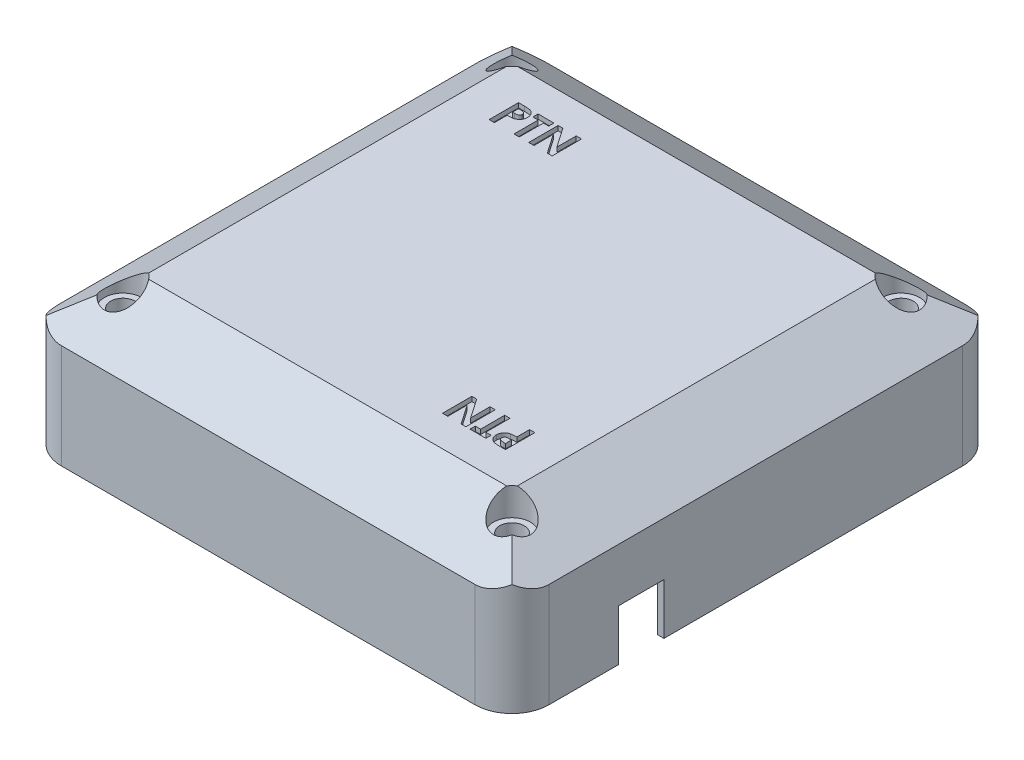
from build123d import *
from OCP.BRepFilletAPI import BRepFilletAPI_MakeChamfer

# Parameters (mm, degrees)
SIDEWALLS_W         = 105.3
SIDEWALLS_H         = 105.3
SIDEWALLS_W_2       = 102.6
SIDEWALLS_H_2       = 102.6
BOSS_EXTRUDE1_DEPTH = 22.5
CEILING_W           = 105.3
CEILING_H           = 105.3
BOSS_EXTRUDE2_DEPTH = 3
DRAFTED_ROOF_W      = 105.3
DRAFTED_ROOF_H      = 105.3
BOSS_EXTRUDE3_DEPTH = 6
CHAMFER1_SIZE       = 9
CHAMFER1_SIZE2      = 12.853332061
SCREWHOLES_HEADS_R  = 4
CUT_EXTRUDE1_DEPTH  = 6
STANDOFFS_R         = 3.65
BOSS_EXTRUDE4_DEPTH = 14.75
CUT_EXTRUDE2_REACH  = 154.212
SCREWHOLES_SHAFTS_R = 2.65
FILLET1_R           = 8
CUT_EXTRUDE3_START  = 30.5
CUT_EXTRUDE3_DEPTH  = 1
CUT_EXTRUDE4_REACH  = 154.212
SMA_PORT_W          = 9.8
SMA_PORT_H          = 11
CUT_EXTRUDE5_REACH  = 154.212
POWERANDCAN_PORT_W  = 4
POWERANDCAN_PORT_H  = 12.5
NRF_MOUNT_W         = 16.8
NRF_MOUNT_H         = 32.8
CUT_EXTRUDE6_DEPTH  = 3.3
CUT_EXTRUDE7_DEPTH  = 3.6
NRF_MOUNT_LIP_W     = 16.8
NRF_MOUNT_LIP_H     = 2
BOSS_EXTRUDE5_DEPTH = 3
FILLET2_R           = 2


# Read off the part's stored shape, not the designer's step: Cut-Extrude3
with BuildPart() as part:
    # Sidewalls → Boss-Extrude1 (new body)
    with BuildSketch(Plane(origin=(0, 0, 0), x_dir=(1, 0, 0), z_dir=(0, 1, 0))):
        with Locations((52.65, -52.65)):
            Rectangle(SIDEWALLS_W, SIDEWALLS_H)
        with Locations((52.65, -52.65)):
            Rectangle(SIDEWALLS_W_2, SIDEWALLS_H_2, mode=Mode.SUBTRACT)
    extrude(amount=BOSS_EXTRUDE1_DEPTH)

    # Ceiling → Boss-Extrude2 (add)
    with BuildSketch(Plane(origin=(0, 22.5, 0), x_dir=(1, 0, 0), z_dir=(0, 1, 0))):
        with Locations((52.65, -52.65)):
            Rectangle(CEILING_W, CEILING_H)
    extrude(amount=BOSS_EXTRUDE2_DEPTH)

    # Drafted_Roof → Boss-Extrude3 (add)
    with BuildSketch(Plane(origin=(0, 25.5, 0), x_dir=(1, 0, 0), z_dir=(0, 1, 0))):
        with Locations((52.65, -52.65)):
            Rectangle(DRAFTED_ROOF_W, DRAFTED_ROOF_H)
    extrude(amount=BOSS_EXTRUDE3_DEPTH)

    # Chamfer1: one chamfer whose edges measure the first distance from different faces: ONE call of the kernel's chamfer builder (chamfer() names one face for all edges)
    chamfer1_edges_1 = [part.edges().sort_by_distance(p)[0] for p in [
        (0, 31.5, 52.65),
    ]]
    chamfer1_side_1 = [part.faces().sort_by_distance(p)[0] for p in [
        (0, 15.75, 52.65),
    ]]
    chamfer1_edges_2 = [part.edges().sort_by_distance(p)[0] for p in [
        (52.65, 31.5, 105.3),
    ]]
    chamfer1_side_2 = [part.faces().sort_by_distance(p)[0] for p in [
        (52.65, 15.75, 105.3),
    ]]
    chamfer1_edges_3 = [part.edges().sort_by_distance(p)[0] for p in [
        (105.3, 31.5, 52.65),
    ]]
    chamfer1_side_3 = [part.faces().sort_by_distance(p)[0] for p in [
        (105.3, 15.75, 52.65),
    ]]
    chamfer1_edges_4 = [part.edges().sort_by_distance(p)[0] for p in [
        (52.65, 31.5, 0),
    ]]
    chamfer1_side_4 = [part.faces().sort_by_distance(p)[0] for p in [
        (52.65, 15.75, 0),
    ]]
    chamfer1 = BRepFilletAPI_MakeChamfer(part.part.solid().wrapped)
    for e in chamfer1_edges_1:
        chamfer1.Add(CHAMFER1_SIZE, CHAMFER1_SIZE2, e.wrapped, chamfer1_side_1[0].wrapped)  # the first distance lies on this face
    for e in chamfer1_edges_2:
        chamfer1.Add(CHAMFER1_SIZE, CHAMFER1_SIZE2, e.wrapped, chamfer1_side_2[0].wrapped)  # the first distance lies on this face
    for e in chamfer1_edges_3:
        chamfer1.Add(CHAMFER1_SIZE, CHAMFER1_SIZE2, e.wrapped, chamfer1_side_3[0].wrapped)  # the first distance lies on this face
    for e in chamfer1_edges_4:
        chamfer1.Add(CHAMFER1_SIZE, CHAMFER1_SIZE2, e.wrapped, chamfer1_side_4[0].wrapped)  # the first distance lies on this face
    add(Compound.cast(chamfer1.Shape()), mode=Mode.REPLACE)

    # ScrewHoles_Heads → Cut-Extrude1 (cut)
    with BuildSketch(Plane(origin=(0, 31.5, 0), x_dir=(1, 0, 0), z_dir=(0, 1, 0))):
        with Locations(Location((10.65, -10.65, 0), (0, 0, 270))):
            Circle(SCREWHOLES_HEADS_R)
        with Locations(Location((94.65, -10.65, 0), (0, 0, 270))):
            Circle(SCREWHOLES_HEADS_R)
        with Locations(Location((94.65, -94.65, 0), (0, 0, 270))):
            Circle(SCREWHOLES_HEADS_R)
        with Locations(Location((10.65, -94.65, 0), (0, 0, 270))):
            Circle(SCREWHOLES_HEADS_R)
    extrude(amount=-CUT_EXTRUDE1_DEPTH, mode=Mode.SUBTRACT)

    # Standoffs → Boss-Extrude4 (add)
    with BuildSketch(Plane.XZ.offset(-22.5)):
        with Locations(Location((10.65, 94.65, 0), (0, 0, 90))):
            Circle(STANDOFFS_R)
        with Locations(Location((94.65, 94.65, 0), (0, 0, 90))):
            Circle(STANDOFFS_R)
        with Locations(Location((94.65, 10.65, 0), (0, 0, 90))):
            Circle(STANDOFFS_R)
        with Locations(Location((10.65, 10.65, 0), (0, 0, 90))):
            Circle(STANDOFFS_R)
    extrude(amount=BOSS_EXTRUDE4_DEPTH)

    # ScrewHoles_Shafts → Cut-Extrude2 (cut, up to next)
    with BuildSketch(Plane(origin=(0, 31.5, 0), x_dir=(1, 0, 0), z_dir=(0, 1, 0)), mode=Mode.PRIVATE) as cut_extrude2_sk1:
        with Locations(Location((10.65, -10.65, 0), (0, 0, 270))):
            Circle(SCREWHOLES_SHAFTS_R)
    cut_extrude2_tool1 = extrude(cut_extrude2_sk1.sketch, amount=-CUT_EXTRUDE2_REACH, mode=Mode.PRIVATE) & part.part
    # ScrewHoles_Shafts → Cut-Extrude2 (cut, up to next)
    with BuildSketch(Plane(origin=(0, 31.5, 0), x_dir=(1, 0, 0), z_dir=(0, 1, 0)), mode=Mode.PRIVATE) as cut_extrude2_sk2:
        with Locations(Location((94.65, -10.65, 0), (0, 0, 270))):
            Circle(SCREWHOLES_SHAFTS_R)
    cut_extrude2_tool2 = extrude(cut_extrude2_sk2.sketch, amount=-CUT_EXTRUDE2_REACH, mode=Mode.PRIVATE) & part.part
    # ScrewHoles_Shafts → Cut-Extrude2 (cut, up to next)
    with BuildSketch(Plane(origin=(0, 31.5, 0), x_dir=(1, 0, 0), z_dir=(0, 1, 0)), mode=Mode.PRIVATE) as cut_extrude2_sk3:
        with Locations(Location((94.65, -94.65, 0), (0, 0, 270))):
            Circle(SCREWHOLES_SHAFTS_R)
    cut_extrude2_tool3 = extrude(cut_extrude2_sk3.sketch, amount=-CUT_EXTRUDE2_REACH, mode=Mode.PRIVATE) & part.part
    # ScrewHoles_Shafts → Cut-Extrude2 (cut, up to next)
    with BuildSketch(Plane(origin=(0, 31.5, 0), x_dir=(1, 0, 0), z_dir=(0, 1, 0)), mode=Mode.PRIVATE) as cut_extrude2_sk4:
        with Locations(Location((10.65, -94.65, 0), (0, 0, 270))):
            Circle(SCREWHOLES_SHAFTS_R)
    cut_extrude2_tool4 = extrude(cut_extrude2_sk4.sketch, amount=-CUT_EXTRUDE2_REACH, mode=Mode.PRIVATE) & part.part
    add(cut_extrude2_tool1.solids().sort_by_distance((10.65, 31.5, 10.65))[0], mode=Mode.SUBTRACT)
    add(cut_extrude2_tool2.solids().sort_by_distance((94.65, 31.5, 10.65))[0], mode=Mode.SUBTRACT)
    add(cut_extrude2_tool3.solids().sort_by_distance((94.65, 31.5, 94.65))[0], mode=Mode.SUBTRACT)
    add(cut_extrude2_tool4.solids().sort_by_distance((10.65, 31.5, 94.65))[0], mode=Mode.SUBTRACT)

    # Fillet1
    fillet1_edges = [part.edges().sort_by_distance(p)[0] for p in [
        (1.35, 11.25, 103.95),
        (103.95, 11.25, 103.95),
        (103.95, 11.25, 1.35),
        (1.35, 11.25, 1.35),
        (105.3, 11.25, 105.3),
        (0, 11.25, 105.3),
        (105.3, 11.25, 0),
        (0, 11.25, 0),
    ]]
    fillet(fillet1_edges, radius=FILLET1_R)

    # Cut-Extrude3 outline → Cut-Extrude3 (cut)
    # profile 1 of 6: a face of its own
    with BuildSketch(Plane(origin=(0, 0, 0), x_dir=(1, 0, 0), z_dir=(0, 1, 0)).offset(CUT_EXTRUDE3_START)):
        with BuildLine():
            add(Edge.make_bspline(
                [(83.115017298, -85.796667939), (83.031904164, -85.796295908), (82.871561507, -85.795578181), (82.640334212, -85.786874768), (82.427015682, -85.771277764), (82.231655054, -85.752002205), (82.054332236, -85.72497906), (81.894826525, -85.693997802), (81.753100463, -85.656257971), (81.627569881, -85.61144743), (81.514875491, -85.558663763), (81.408355558, -85.502284962), (81.309613278, -85.435456622), (81.216330463, -85.362995861), (81.129212751, -85.283395196), (81.047614584, -85.196969227), (80.972376195, -85.102461934), (80.903969281, -85.000524385), (80.841879575, -84.893231959), (80.78764288, -84.780339983), (80.743646807, -84.661684194), (80.70674022, -84.538028274), (80.677096316, -84.40937868), (80.657364433, -84.27494391), (80.643961532, -84.13566272), (80.642778912, -84.040867851), (80.64218076, -83.992921946)],
                knots=[0, 0, 0, 0, 0.070782813, 0.136554884, 0.197017081, 0.252928598, 0.303693621, 0.349727315, 0.391249604, 0.428488557, 0.463067374, 0.497161963, 0.531014729, 0.564460573, 0.597691279, 0.631412817, 0.665589541, 0.700444444, 0.735874519, 0.771086765, 0.806970339, 0.84353075, 0.880937416, 0.9192925, 0.959179287, 1, 1, 1, 1], degree=3))
            Line((83.115017298, -85.796667939), (84.387052555, -85.796667939))
            Line((84.387052555, -85.796667939), (84.387052555, -79.446667939))
            Line((84.387052555, -79.446667939), (83.247308965, -79.446667939))
            Line((83.247308965, -79.446667939), (83.247308965, -82.214616657))
            add(Edge.make_bspline(
                [(81.953649109, -82.311291337), (81.986201424, -82.303192268), (82.056720221, -82.285647077), (82.173409461, -82.267834305), (82.307881558, -82.251456556), (82.460571349, -82.237381863), (82.631566863, -82.227814352), (82.820702531, -82.220342551), (83.028064066, -82.21490978), (83.172255079, -82.214717002), (83.247308965, -82.214616657)],
                knots=[0, 0, 0, 0, 0.077372749, 0.167614291, 0.272108317, 0.390015992, 0.52136331, 0.667272254, 0.826809521, 1, 1, 1, 1], degree=3))
            add(Edge.make_bspline(
                [(80.64218076, -83.992921946), (80.64304246, -83.939878997), (80.644735808, -83.835643083), (80.661461484, -83.682872213), (80.689752043, -83.537119882), (80.72762518, -83.397763434), (80.777025408, -83.26510774), (80.838940428, -83.140024242), (80.90976273, -83.020945552), (80.993371274, -82.91004963), (81.085758981, -82.806771968), (81.185239424, -82.709988644), (81.294797561, -82.623677632), (81.410522921, -82.54335173), (81.535726733, -82.473725736), (81.666699447, -82.409254969), (81.806762904, -82.354545618), (81.904232449, -82.325843296), (81.953649109, -82.311291337)],
                knots=[0, 0, 0, 0, 0.068860469, 0.135319284, 0.199246039, 0.261493284, 0.322649767, 0.382733531, 0.442506181, 0.502301651, 0.562750119, 0.622329724, 0.682264456, 0.743658422, 0.805054856, 0.86809577, 0.933125096, 1, 1, 1, 1], degree=3))
        make_face()
        with BuildLine():
            add(Edge.make_bspline(
                [(82.080852635, -84.530992859), (82.101010789, -84.541187416), (82.143689731, -84.562771381), (82.216376109, -84.587864318), (82.300255078, -84.609032975), (82.395892917, -84.626602757), (82.502908099, -84.640238731), (82.62128153, -84.650666841), (82.751187409, -84.65486039), (82.841529174, -84.656217387), (82.888595023, -84.65692435)],
                knots=[0, 0, 0, 0, 0.08210116, 0.173824981, 0.278953094, 0.396639095, 0.527315592, 0.671298143, 0.82875438, 1, 1, 1, 1], degree=3))
            add(Edge.make_bspline(
                [(81.78192435, -83.994193981), (81.782919522, -84.023938621), (81.784850394, -84.081650373), (81.799230601, -84.164884164), (81.821549415, -84.242323048), (81.855659392, -84.312887549), (81.897072012, -84.37822352), (81.949609071, -84.436297036), (82.010195099, -84.488986972), (82.057048768, -84.516841466), (82.080852635, -84.530992859)],
                knots=[0, 0, 0, 0, 0.137806221, 0.267377201, 0.390496855, 0.51006691, 0.629459141, 0.747795142, 0.871868075, 1, 1, 1, 1], degree=3))
            add(Edge.make_bspline(
                [(82.844073789, -83.354360247), (82.770697583, -83.354823769), (82.635684274, -83.355676658), (82.451320429, -83.368075706), (82.303113504, -83.386927123), (82.186155855, -83.41418511), (82.093771085, -83.454772323), (82.015049694, -83.503724711), (81.945110657, -83.56254988), (81.886810975, -83.633072094), (81.839302368, -83.711752438), (81.805980389, -83.79918502), (81.784948985, -83.893972573), (81.782951554, -83.96015753), (81.78192435, -83.994193981)],
                knots=[0, 0, 0, 0, 0.155195977, 0.285562903, 0.390594379, 0.471085489, 0.538571793, 0.603033861, 0.666660558, 0.730972685, 0.795733593, 0.86019566, 0.92810385, 1, 1, 1, 1], degree=3))
            Line((82.844073789, -83.354360247), (83.247308965, -83.354360247))
            Line((83.247308965, -83.354360247), (83.247308965, -84.65692435))
            Line((83.247308965, -84.65692435), (82.888595023, -84.65692435))
        make_face(mode=Mode.SUBTRACT)
    # profile 2 of 6: a face of its own
    with BuildSketch(Plane(origin=(0, 0, 0), x_dir=(1, 0, 0), z_dir=(0, 1, 0)).offset(CUT_EXTRUDE3_START)):
        with BuildLine():
            add(Edge.make_bspline(
                [(22.184982702, -19.503332061), (22.268095835, -19.503704093), (22.428438491, -19.504421821), (22.659665793, -19.513125226), (22.872984301, -19.528722257), (23.068345004, -19.547997722), (23.245667576, -19.575021174), (23.405174078, -19.606001445), (23.546897611, -19.643744433), (23.672436318, -19.688544835), (23.785103253, -19.74136276), (23.891722512, -19.79761762), (23.989884487, -19.864755811), (24.084543711, -19.935541464), (24.170288353, -20.016736706), (24.252467675, -20.102937875), (24.327601161, -20.197563639), (24.39603695, -20.299468578), (24.458118756, -20.406769925), (24.512357575, -20.519659503), (24.556353067, -20.638315948), (24.593259815, -20.761971687), (24.622903674, -20.890621331), (24.64263557, -21.025056087), (24.656038467, -21.164337281), (24.657221087, -21.25913215), (24.65781924, -21.307078054)],
                knots=[0, 0, 0, 0, 0.070781161, 0.136551696, 0.197012482, 0.252922694, 0.303686532, 0.349719151, 0.391240471, 0.428478555, 0.463056565, 0.497150358, 0.531002334, 0.564226377, 0.59770067, 0.631421421, 0.665597347, 0.700451436, 0.735880684, 0.771092108, 0.806974845, 0.843534403, 0.880940196, 0.919294384, 0.95918024, 1, 1, 1, 1], degree=3))
            Line((22.184982702, -19.503332061), (20.912947445, -19.503332061))
            Line((20.912947445, -19.503332061), (20.912947445, -25.853332061))
            Line((20.912947445, -25.853332061), (22.052691035, -25.853332061))
            Line((22.052691035, -25.853332061), (22.052691035, -23.085383343))
            add(Edge.make_bspline(
                [(23.346350891, -22.988708663), (23.313798576, -22.996807732), (23.243279779, -23.014352923), (23.126590539, -23.032165695), (22.992118442, -23.048543444), (22.839428651, -23.062618137), (22.668433137, -23.072185648), (22.479297469, -23.079657449), (22.271935934, -23.08509022), (22.127744921, -23.085282998), (22.052691035, -23.085383343)],
                knots=[0, 0, 0, 0, 0.077372749, 0.167614291, 0.272108317, 0.390015992, 0.52136331, 0.667272254, 0.826809521, 1, 1, 1, 1], degree=3))
            add(Edge.make_bspline(
                [(24.65781924, -21.307078054), (24.656953788, -21.360119467), (24.655253068, -21.464352361), (24.638580533, -21.617144995), (24.610098575, -21.762818938), (24.572874146, -21.902602685), (24.520967327, -22.034196482), (24.461666224, -22.160740199), (24.388707058, -22.278685937), (24.305339546, -22.389509057), (24.214292713, -22.494110601), (24.11340511, -22.589470399), (24.004599698, -22.676238515), (23.888506312, -22.755324286), (23.764689104, -22.826568177), (23.633237414, -22.890637313), (23.493253614, -22.945482563), (23.395773108, -22.974166185), (23.346350891, -22.988708663)],
                knots=[0, 0, 0, 0, 0.068875425, 0.135348675, 0.199289315, 0.26155008, 0.322915384, 0.382771997, 0.442843572, 0.502652029, 0.562748843, 0.622739582, 0.682687332, 0.743329247, 0.805012514, 0.86806712, 0.933110571, 1, 1, 1, 1], degree=3))
        make_face()
        with BuildLine():
            add(Edge.make_bspline(
                [(23.219147365, -20.769007141), (23.198989211, -20.758812584), (23.156310269, -20.737228619), (23.083623891, -20.712135682), (22.999744922, -20.690967025), (22.904107083, -20.673397243), (22.797091901, -20.659761269), (22.67871847, -20.649333159), (22.548812591, -20.64513961), (22.458470826, -20.643782613), (22.411404977, -20.64307565)],
                knots=[0, 0, 0, 0, 0.08210116, 0.173824981, 0.278953094, 0.396639095, 0.527315592, 0.671298143, 0.82875438, 1, 1, 1, 1], degree=3))
            add(Edge.make_bspline(
                [(23.51807565, -21.305806019), (23.517073475, -21.276064938), (23.515129014, -21.218360091), (23.500844475, -21.135077684), (23.478079029, -21.0574413), (23.445092772, -20.986261749), (23.402449353, -20.921659975), (23.350458396, -20.863661428), (23.289787046, -20.811024021), (23.242945217, -20.783162237), (23.219147365, -20.769007141)],
                knots=[0, 0, 0, 0, 0.137787685, 0.267341238, 0.390444331, 0.511777883, 0.629508981, 0.747829066, 0.87188531, 1, 1, 1, 1], degree=3))
            add(Edge.make_bspline(
                [(22.455926211, -21.945639753), (22.529301218, -21.945174498), (22.66431232, -21.944318423), (22.848689808, -21.931939079), (22.996859105, -21.913033319), (23.1139156, -21.885918087), (23.206342791, -21.844767132), (23.286055456, -21.797163227), (23.354427044, -21.736969395), (23.413626776, -21.668187643), (23.460955178, -21.589153962), (23.493774959, -21.501155263), (23.515094044, -21.406040492), (23.517063059, -21.339846907), (23.51807565, -21.305806019)],
                knots=[0, 0, 0, 0, 0.155159592, 0.285495954, 0.390502806, 0.470975045, 0.538445527, 0.60365534, 0.666587169, 0.73019895, 0.794944675, 0.860228437, 0.928120706, 1, 1, 1, 1], degree=3))
            Line((22.455926211, -21.945639753), (22.052691035, -21.945639753))
            Line((22.052691035, -21.945639753), (22.052691035, -20.64307565))
            Line((22.052691035, -20.64307565), (22.411404977, -20.64307565))
        make_face(mode=Mode.SUBTRACT)
    # profile 3 of 6: a face of its own
    with BuildSketch(Plane(origin=(0, 0, 0), x_dir=(1, 0, 0), z_dir=(0, 1, 0)).offset(CUT_EXTRUDE3_START)):
        Polygon((25.146280779, -19.503332061), (25.146280779, -20.64307565), (26.286024368, -20.64307565), (26.286024368, -25.853332061), (27.425767958, -25.853332061), (27.425767958, -20.64307565), (28.565511548, -20.64307565), (28.565511548, -19.503332061), align=None)
    # profile 4 of 6: a face of its own
    with BuildSketch(Plane(origin=(0, 0, 0), x_dir=(1, 0, 0), z_dir=(0, 1, 0)).offset(CUT_EXTRUDE3_START)):
        Polygon((30.48755682, -19.503332061), (29.461024368, -19.503332061), (29.461024368, -25.853332061), (30.600767958, -25.853332061), (30.600767958, -21.687416596), (33.474295602, -25.853332061), (34.508460266, -25.853332061), (34.508460266, -19.503332061), (33.368716676, -19.503332061), (33.368716676, -23.681967878), align=None)
    # profile 5 of 6: a face of its own
    with BuildSketch(Plane(origin=(0, 0, 0), x_dir=(1, 0, 0), z_dir=(0, 1, 0)).offset(CUT_EXTRUDE3_START)):
        Polygon((76.734488452, -85.796667939), (80.153719221, -85.796667939), (80.153719221, -84.65692435), (79.013975632, -84.65692435), (79.013975632, -79.446667939), (77.874232042, -79.446667939), (77.874232042, -84.65692435), (76.734488452, -84.65692435), align=None)
    # profile 6 of 6: a face of its own
    with BuildSketch(Plane(origin=(0, 0, 0), x_dir=(1, 0, 0), z_dir=(0, 1, 0)).offset(CUT_EXTRUDE3_START)):
        Polygon((74.81244318, -85.796667939), (75.838975632, -85.796667939), (75.838975632, -79.446667939), (74.699232042, -79.446667939), (74.699232042, -83.612583404), (71.825704398, -79.446667939), (70.791539734, -79.446667939), (70.791539734, -85.796667939), (71.931283324, -85.796667939), (71.931283324, -81.618032122), align=None)
    extrude(amount=CUT_EXTRUDE3_DEPTH, mode=Mode.SUBTRACT)

    # SMA_Port → Cut-Extrude4 (cut, up to next)
    with BuildSketch(Plane(origin=(105.3, 0, 0), x_dir=(0, 0, -1), z_dir=(1, 0, 0)), mode=Mode.PRIVATE) as cut_extrude4_sk1:
        with Locations((-77.4, 5.5)):
            Rectangle(SMA_PORT_W, SMA_PORT_H)
    cut_extrude4_tool1 = extrude(cut_extrude4_sk1.sketch, amount=-CUT_EXTRUDE4_REACH, mode=Mode.PRIVATE) & part.part
    add(cut_extrude4_tool1.solids().sort_by_distance((105.3, 5.5, 77.4))[0], mode=Mode.SUBTRACT)

    # PowerAndCan_Port → Cut-Extrude5 (cut, up to next)
    with BuildSketch(Plane.ZY, mode=Mode.PRIVATE) as cut_extrude5_sk1:
        with Locations((37.9, 6.25)):
            Rectangle(POWERANDCAN_PORT_W, POWERANDCAN_PORT_H)
    cut_extrude5_tool1 = extrude(cut_extrude5_sk1.sketch, amount=-CUT_EXTRUDE5_REACH, mode=Mode.PRIVATE) & part.part
    add(cut_extrude5_tool1.solids().sort_by_distance((0, 6.25, 37.9))[0], mode=Mode.SUBTRACT)

    # nRF_Mount → Cut-Extrude6 (cut)
    with BuildSketch(Plane.XZ.offset(-22.5)):
        with Locations((85.55, 42.75)):
            Rectangle(NRF_MOUNT_W, NRF_MOUNT_H)
    extrude(amount=-CUT_EXTRUDE6_DEPTH, mode=Mode.SUBTRACT)

    # nRF_Osc_Port → Cut-Extrude7 (cut)
    with BuildSketch(Plane.XZ.offset(-25.8)):
        with BuildLine():
            Line((93.95, 50.45), (93.95, 41.95))
            ThreePointArc((93.95, 41.95), (91.25, 39.25), (88.55, 41.95))
            Line((88.55, 41.95), (88.55, 50.45))
            ThreePointArc((88.55, 50.45), (91.25, 53.15), (93.95, 50.45))
        make_face()
    extrude(amount=-CUT_EXTRUDE7_DEPTH, mode=Mode.SUBTRACT)

    # nRF_Mount_Lip → Boss-Extrude5 (add)
    with BuildSketch(Plane.XY.offset(26.35)):
        with Locations((85.55, 23.5)):
            Rectangle(NRF_MOUNT_LIP_W, NRF_MOUNT_LIP_H)
    extrude(amount=BOSS_EXTRUDE5_DEPTH)

    # Fillet2
    # the kernel refuses this fillet: 2 mm, written as the material it adds along each edge
    with BuildSketch(Plane(origin=(98.633748499, 24.5, 26.35), x_dir=(0, 0, 1), z_dir=(-1, 0, 0))) as fillet2_piece_1:
        with BuildLine():
            CenterArc((1.8734994, 2), FILLET2_R, 200.487315115, 69.512684885)
            Line((0, 1.3), (-0.037469988, 1.286))
            ThreePointArc((-0.037469988, 1.286), (-0.04, 0.65), (-0.04, 0))
            Line((-0.04, 0), (0, -0.04))
            Line((0, -0.04), (1.8734994, -0.04))
            Line((1.8734994, -0.04), (1.8734994, 0))
        make_face()
    extrude(amount=26.167496998)


solid = part.part
